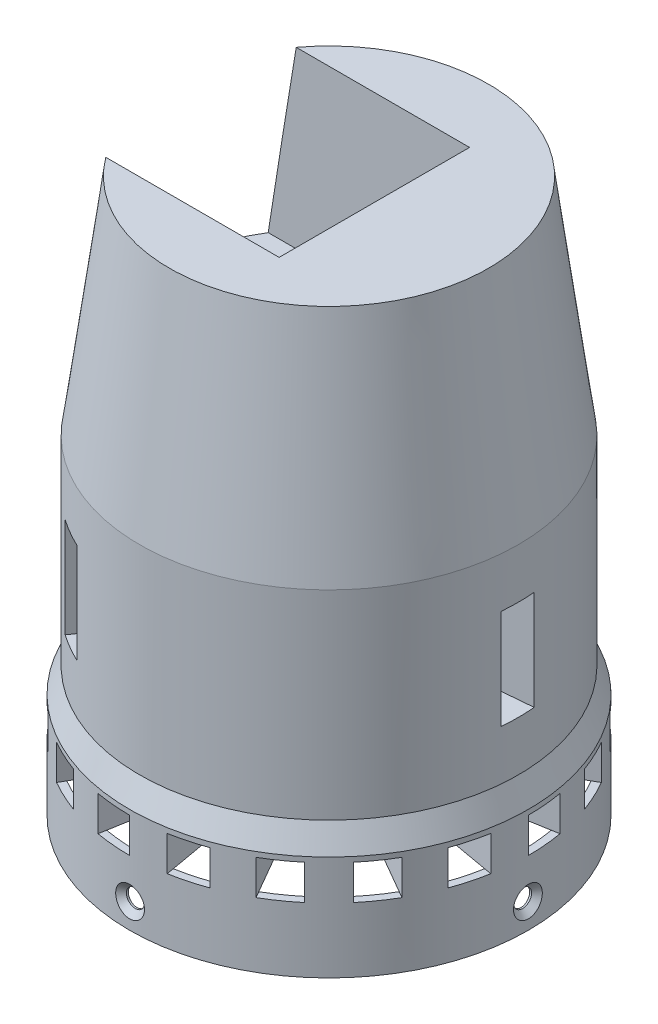
from build123d import *

# Parameters (mm, degrees)
SKETCH1_W               = 20
SKETCH1_H               = 10
SKETCH1_H_2             = 20
SKETCH1_W_2             = 40
SKETCH1_H_3             = 8
CUT_REVOLVE7_START      = -30.004292158
CUT_REVOLVE7_DEPTH      = 20
CIRPATTERN1_COUNT       = 3
CUT_EXTRUDE1_DEPTH      = 9.1
CUT_EXTRUDE1_DEPTH_BACK = 38
SKETCH4_W               = 38.2
SKETCH4_H               = 35
CUT_EXTRUDE2_START      = -7
CUT_EXTRUDE2_DEPTH      = 7
SKETCH7_R               = 40
BOSS_EXTRUDE1_DEPTH     = 13
CUT_EXTRUDE3_DEPTH      = 4
CUT_EXTRUDE3_DEPTH_BACK = 6
SKETCH8_W               = 24.2
SKETCH8_H               = 9.5


# Read off the part's stored shape, not the designer's step: Cut-Revolve7, CSK for M3 Cross Countersunk Head Screw1, CirPattern2
with BuildPart() as part:
    # Sketch1 → Revolve4 (revolve)
    with BuildSketch(Plane.XY, mode=Mode.PRIVATE) as revolve4_sk:
        Polygon((0, 45), (0, 0), (18, 0), (38, 0), (32, 45), align=None)
        with Locations((28, -5)):
            Rectangle(SKETCH1_W, SKETCH1_H)
        Polygon((18, 0), (0, 0), (0, -40), (38, -40), (38, -30), (18, -30), (18, -10), align=None)
        with Locations((28, -20)):
            Rectangle(SKETCH1_W, SKETCH1_H_2)
        Polygon((38, -40), (0, -40), (0, -45), (40, -45), align=None)
        with Locations((20, -49)):
            Rectangle(SKETCH1_W_2, SKETCH1_H_3)
    revolve(revolve4_sk.sketch.rotate(Axis((0, 45, 0), (0, -1, 0)), 180), axis=Axis((0, 45, 0), (0, -1, 0)))

    # Cut-Revolve7 outline → Cut-Revolve7 (cut)
    with BuildSketch(Plane(origin=(0, 0, 0), x_dir=(1, 0, 0), z_dir=(0, 1, 0)).offset(CUT_REVOLVE7_START)):
        with BuildLine():
            ThreePointArc((17.931504566, 1.568803369), (18, 0), (17.931504566, -1.568803369))
            Line((17.931504566, -1.568803369), (37.855398528, -3.311918224))
            ThreePointArc((37.855398528, -3.311918224), (38, 0), (37.855398528, 3.311918224))
            Line((37.855398528, 3.311918224), (17.931504566, 1.568803369))
        make_face()
    cut_revolve7 = extrude(amount=CUT_REVOLVE7_DEPTH, mode=Mode.SUBTRACT)

    # CirPattern1: Cut-Revolve7 ×3 about axis
    cirpattern1_axis = Axis((0, 0, 0), (0, 1, 0))
    for i in range(1, CIRPATTERN1_COUNT):
        add(cut_revolve7.rotate(cirpattern1_axis, i * 360 / CIRPATTERN1_COUNT), mode=Mode.SUBTRACT)

    # Sketch4 → Cut-Extrude1 (cut, two sides: drawn at the far end of the back side and taken through both)
    with BuildSketch(Plane(origin=(0, 0, 0), x_dir=(0, 0, -1), z_dir=(1, 0, 0)).offset(-CUT_EXTRUDE1_DEPTH_BACK)):
        with Locations((0, 27.5)):
            Rectangle(SKETCH4_W, SKETCH4_H)
    extrude(amount=CUT_EXTRUDE1_DEPTH + CUT_EXTRUDE1_DEPTH_BACK, mode=Mode.SUBTRACT)

    # Sketch5 → Cut-Extrude2 (cut)
    with BuildSketch(Plane(origin=(0, -53, 0), x_dir=(-1, 0, 0), z_dir=(0, -1, 0)).offset(CUT_EXTRUDE2_START)):
        with BuildLine():
            ThreePointArc((-5.75, 9.959292144), (-4.86011001, 10.422539551), (-3.933231648, 10.806465139))
            Line((-3.933231648, 10.806465139), (-13.680805733, 37.587704831))
            ThreePointArc((-13.680805733, 37.587704831), (-16.90473047, 36.252311481), (-20, 34.641016151))
            Line((-20, 34.641016151), (-5.75, 9.959292144))
        make_face()
        with BuildLine():
            ThreePointArc((-8.809511096, 7.392057511), (-8.131727984, 8.131727984), (-7.392057511, 8.809511096))
            Line((-7.392057511, 8.809511096), (-25.711504387, 30.641777725))
            ThreePointArc((-25.711504387, 30.641777725), (-28.284271247, 28.284271247), (-30.641777725, 25.711504387))
            Line((-30.641777725, 25.711504387), (-8.809511096, 7.392057511))
        make_face()
        with BuildLine():
            ThreePointArc((-10.806465139, 3.933231648), (-10.422539551, 4.86011001), (-9.959292144, 5.75))
            Line((-9.959292144, 5.75), (-34.641016151, 20))
            ThreePointArc((-34.641016151, 20), (-36.252311481, 16.90473047), (-37.587704831, 13.680805733))
            Line((-37.587704831, 13.680805733), (-10.806465139, 3.933231648))
        make_face()
        with BuildLine():
            ThreePointArc((-11.5, 0), (-11.456239028, 1.002291042), (-11.32528916, 1.996954043))
            Line((-11.32528916, 1.996954043), (-39.39231012, 6.945927107))
            ThreePointArc((-39.39231012, 6.945927107), (-39.847787924, 3.48622971), (-40, 0))
            Line((-40, 0), (-11.5, 0))
        make_face()
        with BuildLine():
            Line((-37.587704831, -13.680805733), (-10.806465139, -3.933231648))
            ThreePointArc((-10.806465139, -3.933231648), (-11.108147002, -2.976419019), (-11.32528916, -1.996954043))
            Line((-11.32528916, -1.996954043), (-39.39231012, -6.945927107))
            ThreePointArc((-39.39231012, -6.945927107), (-38.637033052, -10.352761804), (-37.587704831, -13.680805733))
        make_face()
        with BuildLine():
            Line((-30.641777725, -25.711504387), (-8.809511096, -7.392057511))
            ThreePointArc((-8.809511096, -7.392057511), (-9.420248509, -6.596129018), (-9.959292144, -5.75))
            Line((-9.959292144, -5.75), (-34.641016151, -20))
            ThreePointArc((-34.641016151, -20), (-32.766081772, -22.943057454), (-30.641777725, -25.711504387))
        make_face()
        with BuildLine():
            Line((-20, -34.641016151), (-5.75, -9.959292144))
            ThreePointArc((-5.75, -9.959292144), (-6.596129018, -9.420248509), (-7.392057511, -8.809511096))
            Line((-7.392057511, -8.809511096), (-25.711504387, -30.641777725))
            ThreePointArc((-25.711504387, -30.641777725), (-22.943057454, -32.766081772), (-20, -34.641016151))
        make_face()
        with BuildLine():
            Line((-6.945927107, -39.39231012), (-1.996954043, -11.32528916))
            ThreePointArc((-1.996954043, -11.32528916), (-2.976419019, -11.108147002), (-3.933231648, -10.806465139))
            Line((-3.933231648, -10.806465139), (-13.680805733, -37.587704831))
            ThreePointArc((-13.680805733, -37.587704831), (-10.352761804, -38.637033052), (-6.945927107, -39.39231012))
        make_face()
        with BuildLine():
            Line((6.945927107, -39.39231012), (1.996954043, -11.32528916))
            ThreePointArc((1.996954043, -11.32528916), (1.002291042, -11.456239028), (0, -11.5))
            Line((0, -11.5), (0, -40))
            ThreePointArc((0, -40), (3.48622971, -39.847787924), (6.945927107, -39.39231012))
        make_face()
        with BuildLine():
            Line((20, -34.641016151), (5.75, -9.959292144))
            ThreePointArc((5.75, -9.959292144), (4.86011001, -10.422539551), (3.933231648, -10.806465139))
            Line((3.933231648, -10.806465139), (13.680805733, -37.587704831))
            ThreePointArc((13.680805733, -37.587704831), (16.90473047, -36.252311481), (20, -34.641016151))
        make_face()
        with BuildLine():
            Line((30.641777725, -25.711504387), (8.809511096, -7.392057511))
            ThreePointArc((8.809511096, -7.392057511), (8.131727984, -8.131727984), (7.392057511, -8.809511096))
            Line((7.392057511, -8.809511096), (25.711504387, -30.641777725))
            ThreePointArc((25.711504387, -30.641777725), (28.284271247, -28.284271247), (30.641777725, -25.711504387))
        make_face()
        with BuildLine():
            Line((37.587704831, -13.680805733), (10.806465139, -3.933231648))
            ThreePointArc((10.806465139, -3.933231648), (10.422539551, -4.86011001), (9.959292144, -5.75))
            Line((9.959292144, -5.75), (34.641016151, -20))
            ThreePointArc((34.641016151, -20), (36.252311481, -16.90473047), (37.587704831, -13.680805733))
        make_face()
        with BuildLine():
            Line((40, 0), (11.5, 0))
            ThreePointArc((11.5, 0), (11.456239028, -1.002291042), (11.32528916, -1.996954043))
            Line((11.32528916, -1.996954043), (39.39231012, -6.945927107))
            ThreePointArc((39.39231012, -6.945927107), (39.847787924, -3.48622971), (40, 0))
        make_face()
        with BuildLine():
            ThreePointArc((10.806465139, 3.933231648), (11.108147002, 2.976419019), (11.32528916, 1.996954043))
            Line((11.32528916, 1.996954043), (39.39231012, 6.945927107))
            ThreePointArc((39.39231012, 6.945927107), (38.637033052, 10.352761804), (37.587704831, 13.680805733))
            Line((37.587704831, 13.680805733), (10.806465139, 3.933231648))
        make_face()
        with BuildLine():
            ThreePointArc((8.809511096, 7.392057511), (9.420248509, 6.596129018), (9.959292144, 5.75))
            Line((9.959292144, 5.75), (34.641016151, 20))
            ThreePointArc((34.641016151, 20), (32.766081772, 22.943057454), (30.641777725, 25.711504387))
            Line((30.641777725, 25.711504387), (8.809511096, 7.392057511))
        make_face()
        with BuildLine():
            ThreePointArc((5.75, 9.959292144), (6.596129018, 9.420248509), (7.392057511, 8.809511096))
            Line((7.392057511, 8.809511096), (25.711504387, 30.641777725))
            ThreePointArc((25.711504387, 30.641777725), (22.943057454, 32.766081772), (20, 34.641016151))
            Line((20, 34.641016151), (5.75, 9.959292144))
        make_face()
        with BuildLine():
            ThreePointArc((1.996954043, 11.32528916), (2.976419019, 11.108147002), (3.933231648, 10.806465139))
            Line((3.933231648, 10.806465139), (13.680805733, 37.587704831))
            ThreePointArc((13.680805733, 37.587704831), (10.352761804, 38.637033052), (6.945927107, 39.39231012))
            Line((6.945927107, 39.39231012), (1.996954043, 11.32528916))
        make_face()
        with BuildLine():
            ThreePointArc((-1.996954043, 11.32528916), (-1.002291042, 11.456239028), (0, 11.5))
            Line((0, 11.5), (0, 40))
            ThreePointArc((0, 40), (-3.48622971, 39.847787924), (-6.945927107, 39.39231012))
            Line((-6.945927107, 39.39231012), (-1.996954043, 11.32528916))
        make_face()
    extrude(amount=CUT_EXTRUDE2_DEPTH, mode=Mode.SUBTRACT)

    # Sketch7 → Boss-Extrude1 (add)
    with BuildSketch(Plane(origin=(0, -53, 0), x_dir=(-1, 0, 0), z_dir=(0, -1, 0))):
        Circle(SKETCH7_R)
        with BuildLine():
            Line((36.42, 12.5), (36.42, -12.5))
            ThreePointArc((36.42, -12.5), (-38.494282912, 0), (36.42, 12.5))
        make_face(mode=Mode.SUBTRACT)
    extrude(amount=BOSS_EXTRUDE1_DEPTH)

    # Sketch8 → Cut-Extrude3 (cut, two sides: drawn at the far end of the back side and taken through both)
    with BuildSketch(Plane.ZY.offset(40).offset(-CUT_EXTRUDE3_DEPTH_BACK)):
        with Locations((0, -62.75)):
            Rectangle(SKETCH8_W, SKETCH8_H)
    extrude(amount=CUT_EXTRUDE3_DEPTH + CUT_EXTRUDE3_DEPTH_BACK, mode=Mode.SUBTRACT)

    # CSK for M3 Cross Countersunk Head Sc 2 → CSK for M3 Cross Countersunk Head Screw1 (revolve, cut)
    with BuildSketch(Plane.XZ.offset(61)):
        Polygon((1.8, -38.84117347), (1.8, -38.457608326), (0, -38.457608326), (0, -40.000024409), (3.000025276, -40.000024409), align=None)
    revolve(axis=Axis((0, -61, 0), (0, 0, 1)), mode=Mode.SUBTRACT)

    # CirPattern2 outline → CirPattern2 (revolve, cut)
    with BuildSketch(Plane.XZ.offset(61)):
        Polygon((0, 38.457630909), (1.8, 38.457630909), (1.8, 38.84117347), (3.000024447, 40.000023608), (0, 40.000023608), align=None)
    revolve(axis=Axis((0, -61, 0), (0, 0, 1)), mode=Mode.SUBTRACT)

    # CirPattern2 2 outline → CirPattern2 2 (revolve, cut)
    with BuildSketch(Plane(origin=(0, -61, 0), x_dir=(0, 1, 0), z_dir=(0, 0, -1))):
        Polygon((0, 38.452159323), (1.8, 38.452159323), (1.8, 38.84117347), (3.000025276, 40.000024409), (0, 40.000024409), align=None)
    revolve(axis=Axis((0, -61, 0), (1, 0, 0)), mode=Mode.SUBTRACT)


solid = part.part
